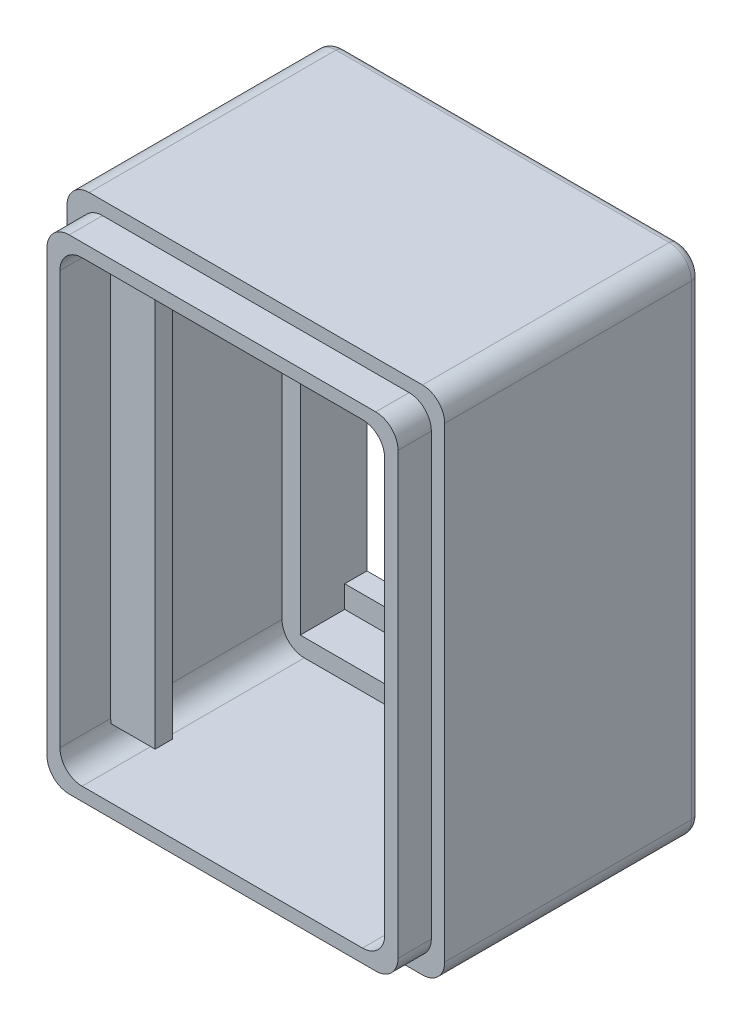
from build123d import *

# Parameters (mm, degrees)
SKETCH1_W           = 43.18
SKETCH1_H           = 58.42
BOSS_EXTRUDE1_DEPTH = 33.02
SKETCH2_W           = 37.132
SKETCH2_H           = 52.324
CUT_EXTRUDE1_DEPTH  = 25.4
SKETCH2_6_W         = 43.18
SKETCH2_6_H         = 58.42
SKETCH2_6_W_2       = 40.132
SKETCH2_6_H_2       = 55.372
CUT_EXTRUDE3_DEPTH  = 3.81
SKETCH5_W           = 2
SKETCH5_H           = 48.26
BOSS_EXTRUDE2_DEPTH = 38.1
SKETCH6_W           = 26.972
SKETCH6_H           = 48.26
CUT_EXTRUDE4_DEPTH  = 7.62
SKETCH8_W           = 33.02
SKETCH8_H           = 48.26
CUT_EXTRUDE5_DEPTH  = 7.62
SKETCH9_W           = 33.02
SKETCH9_H           = 2.54
BOSS_EXTRUDE3_DEPTH = 2.54
SKETCH11_W          = 33.02
SKETCH11_H          = 5.08
BOSS_EXTRUDE4_DEPTH = 7.62
SKETCH12_W          = 12.7
SKETCH12_H          = 5.08
CUT_EXTRUDE6_DEPTH  = 3.81
FILLET1_R           = 2.54
FILLET2_R           = 2.54
FILLET3_R           = 2.54
FILLET4_R           = 2.54
FILLET5_R           = 1


with BuildPart() as part:
    # Sketch1 → Boss-Extrude1 (new body)
    with BuildSketch(Plane.XY):
        with Locations((6.420456459, 29.21)):
            Rectangle(SKETCH1_W, SKETCH1_H)
    extrude(amount=BOSS_EXTRUDE1_DEPTH)

    # Sketch2 → Cut-Extrude1 (cut)
    with BuildSketch(Plane.XY.offset(33.02)):
        with Locations((6.396456459, 29.21)):
            Rectangle(SKETCH2_W, SKETCH2_H)
    extrude(amount=-CUT_EXTRUDE1_DEPTH, mode=Mode.SUBTRACT)

    # Sketch2<6> → Cut-Extrude3 (cut)
    with BuildSketch(Plane.XY.offset(33.02)):
        with Locations((6.420456459, 29.21)):
            Rectangle(SKETCH2_6_W, SKETCH2_6_H)
        with Locations((6.420456459, 29.21)):
            Rectangle(SKETCH2_6_W_2, SKETCH2_6_H_2, mode=Mode.SUBTRACT)
    extrude(amount=-CUT_EXTRUDE3_DEPTH, mode=Mode.SUBTRACT)

    # Sketch5 → Boss-Extrude2 (add)
    with BuildSketch(Plane(origin=(-12.169543541, 0, 0), x_dir=(0, 0, -1), z_dir=(1, 0, 0))):
        with Locations((-26.21, 29.21)):
            Rectangle(SKETCH5_W, SKETCH5_H)
    extrude(amount=BOSS_EXTRUDE2_DEPTH)

    # Sketch6 → Cut-Extrude4 (cut)
    with BuildSketch(Plane.XY.offset(27.21)):
        with Locations((6.396456459, 29.21)):
            Rectangle(SKETCH6_W, SKETCH6_H)
    extrude(amount=-CUT_EXTRUDE4_DEPTH, mode=Mode.SUBTRACT)

    # Sketch8 → Cut-Extrude5 (cut)
    with BuildSketch(Plane(origin=(0, 0, 0), x_dir=(-1, 0, 0), z_dir=(0, 0, -1))):
        with Locations((-6.420456459, 29.21)):
            Rectangle(SKETCH8_W, SKETCH8_H)
    extrude(amount=-CUT_EXTRUDE5_DEPTH, mode=Mode.SUBTRACT)

    # Sketch9 → Boss-Extrude3 (add)
    with BuildSketch(Plane(origin=(0, 5.08, 0), x_dir=(1, 0, 0), z_dir=(0, 1, 0))):
        with Locations((6.420456459, -1.27)):
            Rectangle(SKETCH9_W, SKETCH9_H)
    extrude(amount=BOSS_EXTRUDE3_DEPTH)

    # Sketch11 → Boss-Extrude4 (add)
    with BuildSketch(Plane.XZ.offset(-53.34)):
        with Locations((6.420456459, 5.08)):
            Rectangle(SKETCH11_W, SKETCH11_H)
    extrude(amount=BOSS_EXTRUDE4_DEPTH)

    # Sketch12 → Cut-Extrude6 (cut)
    with BuildSketch(Plane(origin=(0, 0, 2.54), x_dir=(-1, 0, 0), z_dir=(0, 0, -1))):
        with Locations((-6.420456459, 49.784)):
            Rectangle(SKETCH12_W, SKETCH12_H)
    extrude(amount=-CUT_EXTRUDE6_DEPTH, mode=Mode.SUBTRACT)

    # Fillet1
    # the kernel refuses this fillet: 2.54 mm, written as the material it adds along each edge
    with BuildSketch(Plane(origin=(-12.169543541, 3.048, 33.02), x_dir=(1, 0, 0), z_dir=(0, 0, -1)), Plane(origin=(24.962456459, 55.372, 33.02), x_dir=(-1, 0, 0), z_dir=(0, 0, -1)), Plane(origin=(24.962456459, 3.048, 33.02), x_dir=(0, 1, 0), z_dir=(0, 0, -1))) as fillet1_piece_1:
        with BuildLine():
            CenterArc((FILLET1_R, -FILLET1_R), FILLET1_R, 90, 90)
            Line((0, -FILLET1_R), (0, 0))
            Line((0, 0), (FILLET1_R, 0))
        make_face()
    extrude(amount=31.75)
    with BuildSketch(Plane(origin=(-12.169543541, 55.372, 33.02), x_dir=(1, 0, 0), z_dir=(0, 0, -1))) as fillet1_piece_2:
        with BuildLine():
            CenterArc((FILLET1_R, FILLET1_R), FILLET1_R, 180, 90)
            Line((0, FILLET1_R), (0, 0))
            Line((0, 0), (FILLET1_R, 0))
        make_face()
    extrude(amount=31.75)

    # Fillet2
    fillet2_edges = [part.edges().sort_by_distance(p)[0] for p in [
        (-15.169543541, 58.42, 14.605),
        (28.010456459, 58.42, 14.605),
        (26.486456459, 56.896, 31.115),
        (-13.645543541, 56.896, 31.115),
    ]]
    fillet(fillet2_edges, radius=FILLET2_R)

    # Fillet3
    fillet3_edges = [part.edges().sort_by_distance(p)[0] for p in [
        (-15.169543541, 0, 14.605),
        (-13.645543541, 1.524, 31.115),
    ]]
    fillet(fillet3_edges, radius=FILLET3_R)

    # Fillet4
    fillet4_edges = [part.edges().sort_by_distance(p)[0] for p in [
        (28.010456459, 0, 14.605),
        (26.486456459, 1.524, 31.115),
    ]]
    fillet(fillet4_edges, radius=FILLET4_R)

    # Fillet5
    fillet5_edges = [part.edges().sort_by_distance(p)[0] for p in [
        (-15.169543541, 29.21, 0),
        (6.420456459, 58.42, 0),
        (27.266507683, 57.676051224, 0),
        (-14.425594766, 57.676051224, 0),
        (6.420456459, 0, 0),
        (-14.425594766, 0.743948776, 0),
        (28.010456459, 29.21, 0),
        (27.266507683, 0.743948776, 0),
    ]]
    fillet(fillet5_edges, radius=FILLET5_R)


solid = part.part
